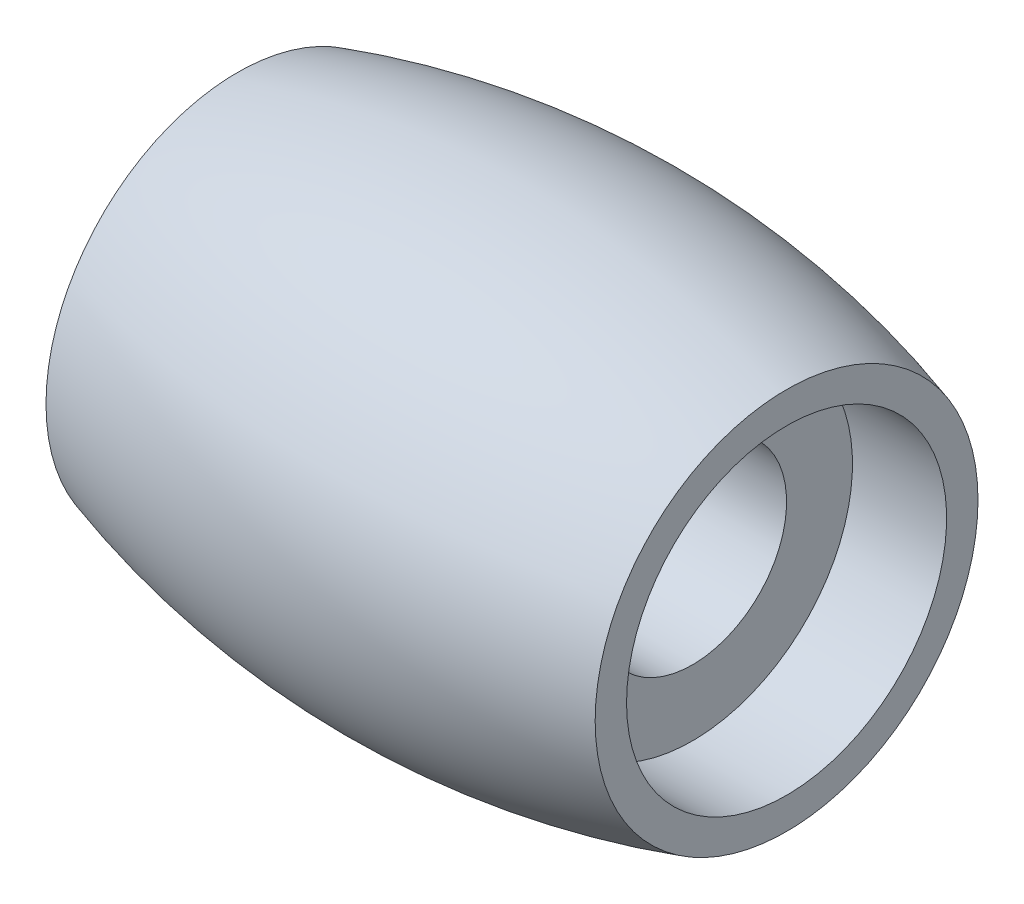
from build123d import *


with BuildPart() as part:
    # Sketch2 → Revolve1 (revolve)
    with BuildSketch(Plane.XY):
        with BuildLine():
            Line((-2.875, 1.5), (2.875, 1.5))
            Line((2.875, 1.5), (2.875, 2.55))
            Line((2.875, 2.55), (4.375, 2.55))
            Line((4.375, 2.55), (4.375, 3.05))
            ThreePointArc((4.375, 3.05), (0, 3.702199646), (-4.375, 3.05))
            Line((-4.375, 3.05), (-4.375, 2.55))
            Line((-4.375, 2.55), (-2.875, 2.55))
            Line((-2.875, 2.55), (-2.875, 1.5))
        make_face()
    revolve(axis=Axis((-8.91796875, 0, 0), (1, 0, 0)))


solid = part.part
